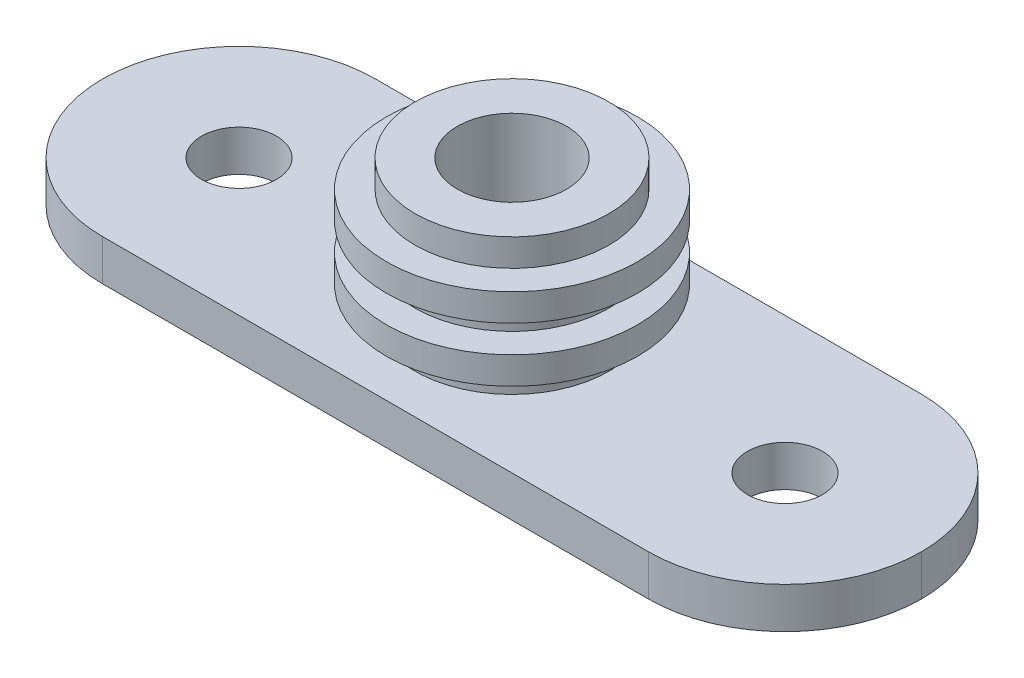
from build123d import *

# Parameters (mm, degrees)
SKETCH1_W            = 60
SKETCH1_H            = 20
BOSS_EXTRUDE1_DEPTH  = 3
FILLET1_R            = 10
SKETCH36_R           = 7.1
BOSS_EXTRUDE15_DEPTH = 2
SKETCH37_R           = 9.2
BOSS_EXTRUDE16_DEPTH = 2
SKETCH39_R           = 7.1
BOSS_EXTRUDE18_DEPTH = 2
SKETCH40_R           = 9.2
BOSS_EXTRUDE19_DEPTH = 2
SKETCH41_R           = 7.1
BOSS_EXTRUDE20_DEPTH = 2
SKETCH42_R           = 4
CUT_EXTRUDE5_DEPTH   = 13
SKETCH43_R           = 2.75
CUT_EXTRUDE6_DEPTH   = 3


with BuildPart() as part:
    # Sketch1 → Boss-Extrude1 (new body)
    with BuildSketch(Plane(origin=(0, 0, 0), x_dir=(1, 0, 0), z_dir=(0, 1, 0))):
        Rectangle(SKETCH1_W, SKETCH1_H)
    extrude(amount=BOSS_EXTRUDE1_DEPTH)

    # Fillet1
    fillet1_edges = [part.edges().sort_by_distance(p)[0] for p in [
        (30, 1.5, -10),
        (30, 1.5, 10),
        (-30, 1.5, 10),
        (-30, 1.5, -10),
    ]]
    fillet(fillet1_edges, radius=FILLET1_R - 0.0001)  # a hair under: the kernel refuses the full size

    # Sketch36 → Boss-Extrude15 (add)
    with BuildSketch(Plane(origin=(0, 3, 0), x_dir=(1, 0, 0), z_dir=(0, 1, 0))):
        with Locations(Location((0, 0, 0), (0, 0, 90))):
            Circle(SKETCH36_R)
    extrude(amount=BOSS_EXTRUDE15_DEPTH)

    # Sketch37 → Boss-Extrude16 (add)
    with BuildSketch(Plane(origin=(0, 5, 0), x_dir=(1, 0, 0), z_dir=(0, 1, 0))):
        with Locations(Location((0, 0, 0), (0, 0, 270))):
            Circle(SKETCH37_R)
    extrude(amount=BOSS_EXTRUDE16_DEPTH)

    # Sketch39 → Boss-Extrude18 (add)
    with BuildSketch(Plane(origin=(0, 7, 0), x_dir=(1, 0, 0), z_dir=(0, 1, 0))):
        with Locations(Location((0, 0, 0), (0, 0, 90))):
            Circle(SKETCH39_R)
    extrude(amount=BOSS_EXTRUDE18_DEPTH)

    # Sketch40 → Boss-Extrude19 (add)
    with BuildSketch(Plane(origin=(0, 9, 0), x_dir=(1, 0, 0), z_dir=(0, 1, 0))):
        with Locations(Location((0, 0, 0), (0, 0, 270))):
            Circle(SKETCH40_R)
    extrude(amount=BOSS_EXTRUDE19_DEPTH)

    # Sketch41 → Boss-Extrude20 (add)
    with BuildSketch(Plane(origin=(0, 11, 0), x_dir=(1, 0, 0), z_dir=(0, 1, 0))):
        with Locations(Location((0, 0, 0), (0, 0, 90))):
            Circle(SKETCH41_R)
    extrude(amount=BOSS_EXTRUDE20_DEPTH)

    # Sketch42 → Cut-Extrude5 (cut)
    with BuildSketch(Plane(origin=(0, 13, 0), x_dir=(1, 0, 0), z_dir=(0, 1, 0))):
        with Locations(Location((0, 0, 0), (0, 0, 270))):
            Circle(SKETCH42_R)
    extrude(amount=-CUT_EXTRUDE5_DEPTH, mode=Mode.SUBTRACT)

    # Sketch43 → Cut-Extrude6 (cut)
    with BuildSketch(Plane(origin=(0, 3, 0), x_dir=(1, 0, 0), z_dir=(0, 1, 0))):
        with Locations(Location((-20, 0, 0), (0, 0, 270))):
            Circle(SKETCH43_R)
        with Locations(Location((20, 0, 0), (0, 0, 270))):
            Circle(SKETCH43_R)
    extrude(amount=-CUT_EXTRUDE6_DEPTH, mode=Mode.SUBTRACT)


solid = part.part
